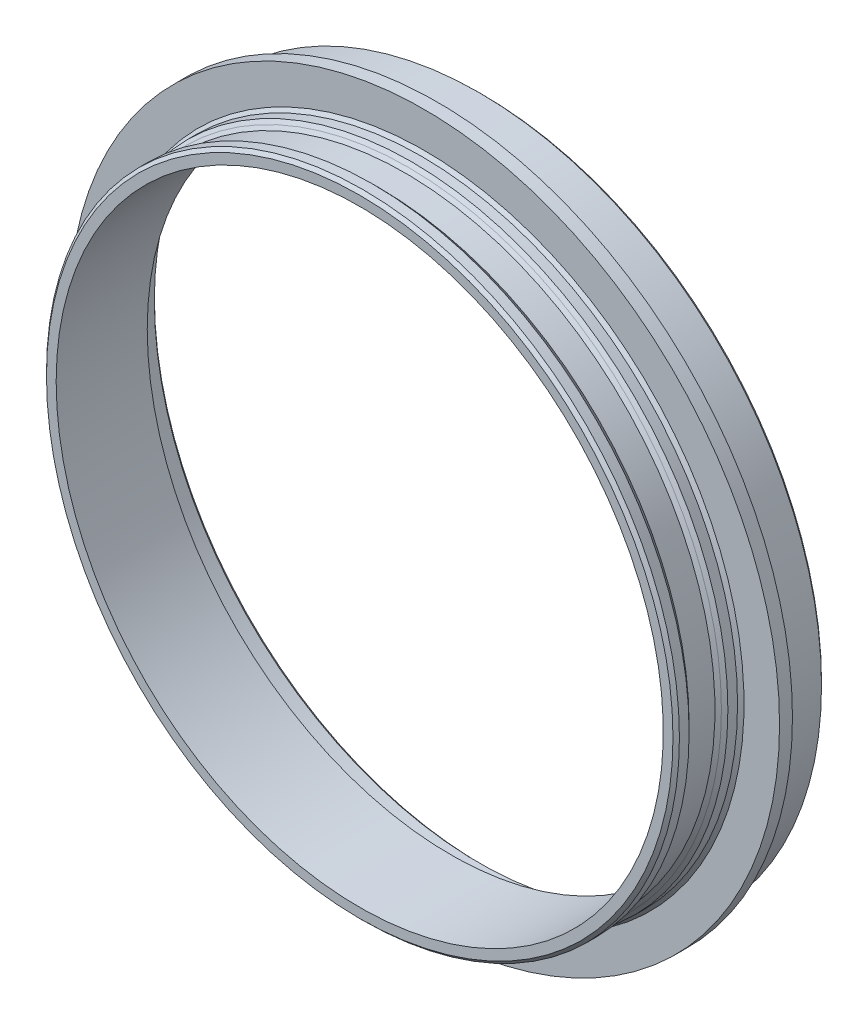
from build123d import *

# Parameters (mm, degrees)
CHAMFER1_SIZE = 0.5


with BuildPart() as part:
    # Sketch1 → Revolve1 (revolve)
    with BuildSketch(Plane(origin=(0, 0, 0), x_dir=(1, 0, 0), z_dir=(0, 1, 0)), mode=Mode.PRIVATE) as revolve1_sk:
        Polygon((50.3, 19), (50.3, 14.1), (47, 14.1), (47, 0), (49, 0), (49, 2.5), (48, 2.5), (48, 7.5), (49, 7.5), (49, 10), (55, 10), (55, 12), (53, 12), (53, 19), align=None)
    revolve(revolve1_sk.sketch.rotate(Axis((0, 0, -69.169847328), (0, 0, 1)), 180), axis=Axis((0, 0, -69.169847328), (0, 0, 1)))

    # Chamfer1
    chamfer1_edges = [part.edges().sort_by_distance(p)[0] for p in [
        (49, 0, -10),
        (49, 0, -7.5),
        (48, 0, -7.5),
        (48, 0, -2.5),
        (49, 0, -2.5),
        (49, 0, 0),
        (50.3, 0, -19),
        (53, 0, -19),
    ]]
    chamfer(chamfer1_edges, length=CHAMFER1_SIZE - 0.0001)  # a hair under: the kernel refuses the full size


solid = part.part
